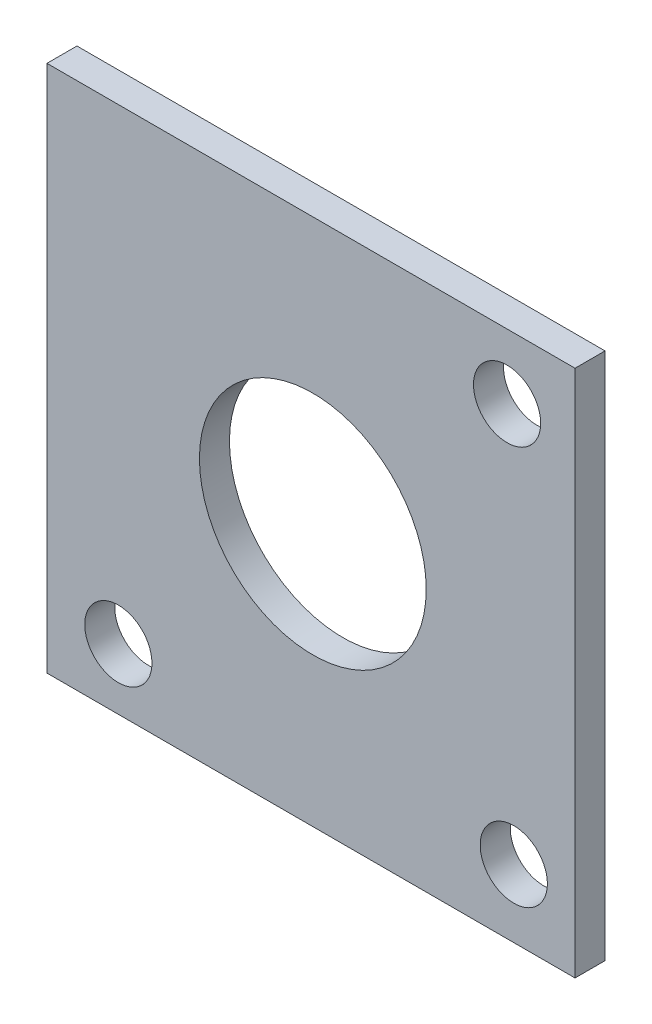
from build123d import *

# Parameters (mm, degrees)
SKETCH2_W           = 1.1
SKETCH2_H           = 1.1
BOSS_EXTRUDE1_DEPTH = 0.0625
SKETCH3_R           = 0.2362
CUT_EXTRUDE1_DEPTH  = 2.556889929
SKETCH4_R           = 0.07
CUT_EXTRUDE2_DEPTH  = 2.556889929


with BuildPart() as part:
    # Sketch2 → Boss-Extrude1 (new body)
    with BuildSketch(Plane.XY):
        with Locations((-0.55, 0.55)):
            Rectangle(SKETCH2_W, SKETCH2_H)
    extrude(amount=BOSS_EXTRUDE1_DEPTH)

    # Sketch3 → Cut-Extrude1 (cut, through all)
    with BuildSketch(Plane.XY.offset(0.0625)):
        with Locations((-0.5461811, 0.545894303)):
            Circle(SKETCH3_R)
    extrude(amount=-CUT_EXTRUDE1_DEPTH, mode=Mode.SUBTRACT)

    # Sketch4 → Cut-Extrude2 (cut, through all)
    with BuildSketch(Plane.XY.offset(0.0625)):
        with Locations((-0.141583904, 0.964840405)):
            Circle(SKETCH4_R)
        with Locations((-0.127578256, 0.141122108)):
            Circle(SKETCH4_R)
        with Locations((-0.951296553, 0.12711646)):
            Circle(SKETCH4_R)
    extrude(amount=-CUT_EXTRUDE2_DEPTH, mode=Mode.SUBTRACT)


solid = part.part
